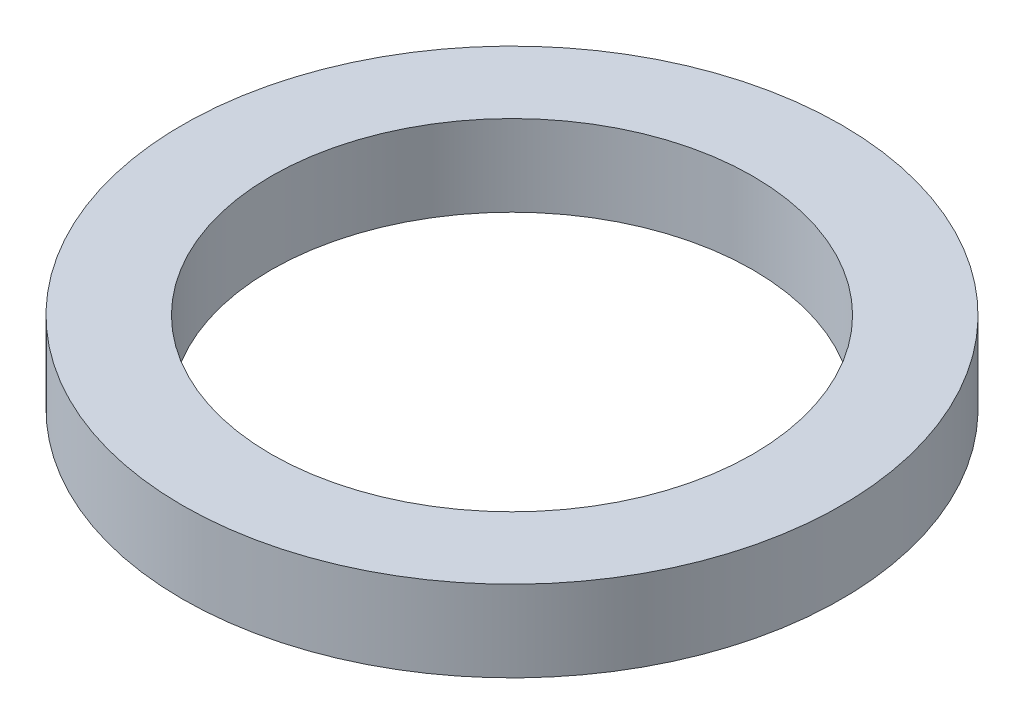
from build123d import *

# Parameters (mm, degrees)
SKETCH1_R           = 65
BOSS_EXTRUDE1_DEPTH = 16
SKETCH2_R           = 47.5
CUT_EXTRUDE1_DEPTH  = 94.305948363


with BuildPart() as part:
    # Sketch1 → Boss-Extrude1 (new body)
    with BuildSketch(Plane(origin=(0, 0, 0), x_dir=(1, 0, 0), z_dir=(0, 1, 0))):
        Circle(SKETCH1_R)
    extrude(amount=BOSS_EXTRUDE1_DEPTH)

    # Sketch2 → Cut-Extrude1 (cut, through all)
    with BuildSketch(Plane(origin=(0, 0, 0), x_dir=(1, 0, 0), z_dir=(0, 1, 0))):
        Circle(SKETCH2_R)
    extrude(amount=CUT_EXTRUDE1_DEPTH, mode=Mode.SUBTRACT)


solid = part.part
